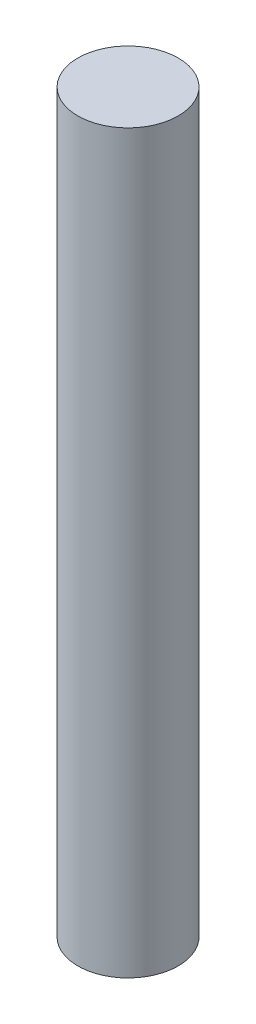
from build123d import *

# Parameters (mm, degrees)
SKETCH1_W = 1.5
SKETCH1_H = 22


with BuildPart() as part:
    # Sketch1 → Revolve1 (revolve)
    with BuildSketch(Plane.XY):
        with Locations((-0.75, 11)):
            Rectangle(SKETCH1_W, SKETCH1_H)
    revolve(axis=Axis((0, 0, 0), (0, 1, 0)))


solid = part.part
